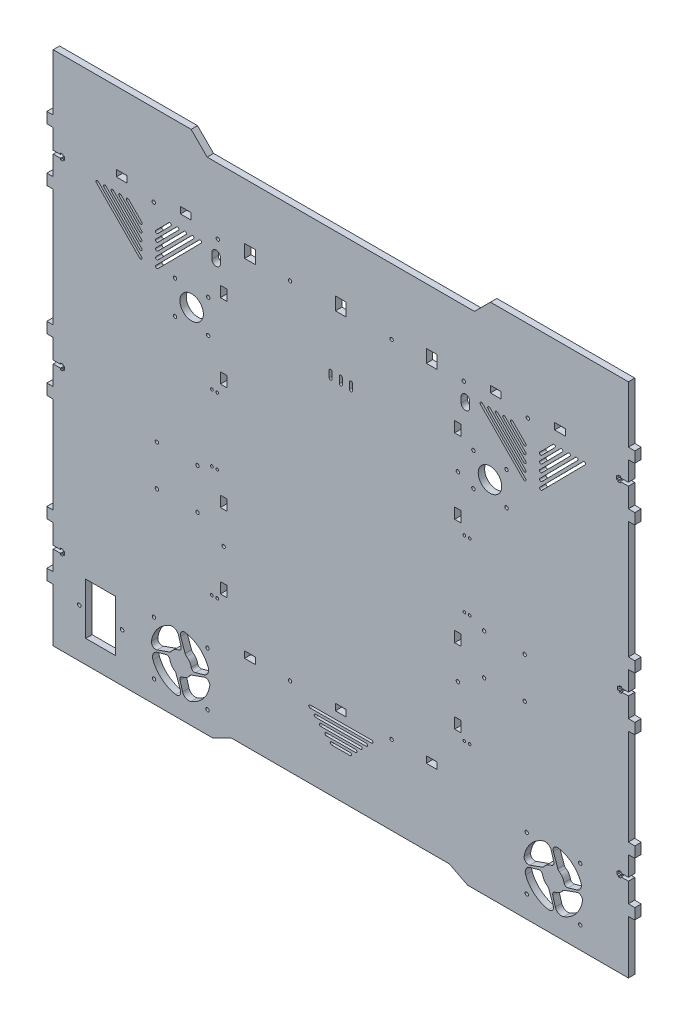
from build123d import *

# Parameters (mm, degrees)
SKETCH_1_R      = 1.6
SKETCH_1_R_2    = 11
SKETCH_1_R_3    = 1.65
SKETCH_1_R_4    = 1.25
SKETCH_1_W      = 10
SKETCH_1_H      = 12.1
SKETCH_1_H_2    = 6.1
SKETCH_1_W_2    = 28.000005
SKETCH_1_H_3    = 48
SKETCH_1_W_3    = 6.1
SKETCH_1_H_4    = 10
EXTRUDE_1_DEPTH = 6


with BuildPart() as part:
    # Эскиз1 → Бобышка-Вытянуть1 (new body)
    with BuildSketch(Plane.XY):
        Polygon((1048.755445299, 41.555928029), (1198.275289364, 41.555928029), (1215.275289364, 50.255928029), (1419.275289364, 50.255928029), (1436.275289364, 41.555928029), (1586.755445299, 41.555928029), (1586.755445299, 42.229895243), (1586.755445299, 91.455928029), (1592.755445299, 91.555920983), (1592.755445299, 101.564061487), (1586.755445299, 101.664059139), (1586.755445299, 120.014059139), (1579.955445299, 120.014059139), (1579.955445299, 118.814059139), (1577.755445299, 118.814059139), (1577.755445299, 120.014059139), (1576.255445299, 120.014059139), (1576.255445299, 123.114059139), (1577.755445299, 123.114059139), (1577.755445299, 124.314059139), (1579.955445299, 124.314059139), (1579.955445299, 123.114059139), (1586.755445299, 123.114059139), (1586.755445299, 141.464059139), (1592.755445299, 141.564052092), (1592.755445299, 151.572190055), (1586.755445299, 151.672187707), (1586.755445299, 241.472187707), (1592.755445299, 241.57218066), (1592.755445299, 251.580316084), (1586.755445299, 251.680313736), (1586.755445299, 270.030313736), (1580.435601234, 270.030313736), (1580.435601234, 268.830313736), (1578.235601234, 268.830313736), (1578.235601234, 270.030313736), (1576.735601234, 270.030313736), (1576.735601234, 273.130313736), (1578.235601234, 273.130313736), (1578.235601234, 274.330313736), (1580.435601234, 274.330313736), (1580.435601234, 273.130313736), (1586.755445299, 273.130313736), (1586.755445299, 291.44780454), (1592.755445299, 291.547797493), (1592.755445299, 301.555930378), (1586.755445299, 301.655928029), (1586.755445299, 411.455928029), (1592.755445299, 411.555920983), (1592.755445299, 421.555920983), (1586.755445299, 421.64840618), (1586.755445299, 440.010210156), (1586.047206734, 440.010210156), (1579.247206734, 440.010210156), (1579.247206734, 438.810210156), (1577.047206734, 438.810210156), (1577.047206734, 440.010210156), (1575.547206734, 440.010210156), (1575.547206734, 443.110210156), (1577.047206734, 443.110210156), (1577.047206734, 444.310210156), (1579.247206734, 444.310210156), (1579.247206734, 443.110210156), (1586.047206734, 443.110210156), (1586.755445299, 443.110210156), (1586.755445299, 461.472014132), (1592.755445299, 461.564485239), (1592.755445299, 471.555920983), (1586.755445299, 471.64840618), (1586.755445299, 524.555928029), (1457.755445299, 524.555928029), (1442.755445299, 509.555928029), (1192.755445299, 509.555928029), (1177.755445299, 524.555928029), (1048.755445299, 524.555928029), (1048.755445299, 471.655928029), (1042.755445299, 471.555928029), (1042.755445299, 461.555928029), (1048.755445299, 461.455928029), (1048.755445299, 443.105928029), (1055.555445299, 443.105928029), (1055.555445299, 444.305928029), (1057.755445299, 444.305928029), (1057.755445299, 443.105928029), (1059.255445299, 443.105928029), (1059.255445299, 440.005928029), (1057.755445299, 440.005928029), (1057.755445299, 438.805928029), (1055.555445299, 438.805928029), (1055.555445299, 440.005928029), (1048.755445299, 440.005928029), (1048.755445299, 421.655928029), (1042.755445299, 421.555928029), (1042.755445299, 411.555928029), (1048.755445299, 411.455928029), (1048.755445299, 301.655928029), (1042.755445299, 301.555928029), (1042.755445299, 291.555928029), (1048.755445299, 291.455928029), (1048.755445299, 273.105928029), (1055.555445299, 273.105928029), (1055.555445299, 274.305928029), (1057.755445299, 274.305928029), (1057.755445299, 273.105928029), (1059.255445299, 273.105928029), (1059.255445299, 270.005928029), (1057.755445299, 270.005928029), (1057.755445299, 268.805928029), (1055.555445299, 268.805928029), (1055.555445299, 270.005928029), (1048.755445299, 270.005928029), (1048.755445299, 251.655928029), (1042.755445299, 251.555928029), (1042.755445299, 241.555928029), (1048.755445299, 241.455928029), (1048.755445299, 151.655928029), (1042.755445299, 151.555928029), (1042.755445299, 141.555928029), (1048.755445299, 141.455928029), (1048.755445299, 123.105928029), (1055.555445299, 123.105928029), (1055.555445299, 124.305928029), (1057.755445299, 124.305928029), (1057.755445299, 123.105928029), (1059.255445299, 123.105928029), (1059.255445299, 120.005928029), (1057.755445299, 120.005928029), (1057.755445299, 118.805928029), (1055.555445299, 118.805928029), (1055.555445299, 120.005928029), (1048.755445299, 120.005928029), (1048.755445299, 101.655928029), (1042.755445299, 101.555928029), (1042.755445299, 91.555928029), (1048.755445299, 91.455928029), (1048.755445299, 42.225613117), align=None)
        with Locations((1193.706756289, 365.50723902)):
            Circle(SKETCH_1_R, mode=Mode.SUBTRACT)
        with Locations((1162.706756289, 365.50723902)):
            Circle(SKETCH_1_R, mode=Mode.SUBTRACT)
        with Locations((1178.206756289, 380.555928029)):
            Circle(SKETCH_1_R_2, mode=Mode.SUBTRACT)
        with Locations((1193.706756289, 396.50723902)):
            Circle(SKETCH_1_R, mode=Mode.SUBTRACT)
        with Locations((1202.755445299, 448.05723902)):
            Circle(SKETCH_1_R, mode=Mode.SUBTRACT)
        with Locations((1432.755445299, 448.05723902)):
            Circle(SKETCH_1_R, mode=Mode.SUBTRACT)
        with Locations((1365.255445299, 448.05723902)):
            Circle(SKETCH_1_R, mode=Mode.SUBTRACT)
        with Locations((1270.255445299, 448.05723902)):
            Circle(SKETCH_1_R, mode=Mode.SUBTRACT)
        with Locations((1162.706756289, 396.50723902)):
            Circle(SKETCH_1_R, mode=Mode.SUBTRACT)
        with Locations((1145.712920123, 217.273882543)):
            Circle(SKETCH_1_R, mode=Mode.SUBTRACT)
        with Locations((1365.255445299, 124.05491402)):
            Circle(SKETCH_1_R, mode=Mode.SUBTRACT)
        with Locations((1270.255445299, 124.05491402)):
            Circle(SKETCH_1_R, mode=Mode.SUBTRACT)
        with Locations((1492.755445299, 448.05723902)):
            Circle(SKETCH_1_R, mode=Mode.SUBTRACT)
        with Locations((1142.755445299, 448.05723902)):
            Circle(SKETCH_1_R, mode=Mode.SUBTRACT)
        with Locations((1073.162844871, 86.87758802)):
            Circle(SKETCH_1_R_3, mode=Mode.SUBTRACT)
        with Locations((1113.162844871, 86.87758802)):
            Circle(SKETCH_1_R_3, mode=Mode.SUBTRACT)
        with Locations((1145.712920123, 255.273882543)):
            Circle(SKETCH_1_R, mode=Mode.SUBTRACT)
        with Locations((1183.712920123, 217.273882543)):
            Circle(SKETCH_1_R, mode=Mode.SUBTRACT)
        with Locations((1183.712920123, 255.273882543)):
            Circle(SKETCH_1_R, mode=Mode.SUBTRACT)
        with Locations((1143.031783229, 112.012971893)):
            Circle(SKETCH_1_R, mode=Mode.SUBTRACT)
        with Locations((1143.031783229, 62.012971893)):
            Circle(SKETCH_1_R, mode=Mode.SUBTRACT)
        with Locations((1541.689341871, 112.012971893)):
            Circle(SKETCH_1_R, mode=Mode.SUBTRACT)
        with Locations((1541.689341871, 62.012971893)):
            Circle(SKETCH_1_R, mode=Mode.SUBTRACT)
        with Locations((1491.689341871, 112.012971893)):
            Circle(SKETCH_1_R, mode=Mode.SUBTRACT)
        with Locations((1491.689341871, 62.012971893)):
            Circle(SKETCH_1_R, mode=Mode.SUBTRACT)
        with Locations((1193.031783229, 62.012971893)):
            Circle(SKETCH_1_R, mode=Mode.SUBTRACT)
        with Locations((1193.031783229, 112.012971893)):
            Circle(SKETCH_1_R, mode=Mode.SUBTRACT)
        with Locations((1427.305445299, 371.90723902)):
            Circle(SKETCH_1_R, mode=Mode.SUBTRACT)
        with Locations((1427.305445299, 201.90723902)):
            Circle(SKETCH_1_R, mode=Mode.SUBTRACT)
        with Locations((1208.205445299, 201.90723902)):
            Circle(SKETCH_1_R, mode=Mode.SUBTRACT)
        with Locations((1202.195892293, 261.19163302)):
            Circle(SKETCH_1_R_4, mode=Mode.SUBTRACT)
        with Locations((1197.224537293, 261.25949102)):
            Circle(SKETCH_1_R_4, mode=Mode.SUBTRACT)
        with Locations((1202.158586293, 156.83802302)):
            Circle(SKETCH_1_R_4, mode=Mode.SUBTRACT)
        with Locations((1197.187231293, 156.90588202)):
            Circle(SKETCH_1_R_4, mode=Mode.SUBTRACT)
        with Locations((1438.308804299, 156.77016502)):
            Circle(SKETCH_1_R_4, mode=Mode.SUBTRACT)
        with Locations((1433.337449299, 156.83802402)):
            Circle(SKETCH_1_R_4, mode=Mode.SUBTRACT)
        with Locations((1472.804134308, 365.50723902)):
            Circle(SKETCH_1_R, mode=Mode.SUBTRACT)
        with Locations((1438.346110299, 261.12377502)):
            Circle(SKETCH_1_R_4, mode=Mode.SUBTRACT)
        with Locations((1441.804134308, 365.50723902)):
            Circle(SKETCH_1_R, mode=Mode.SUBTRACT)
        with Locations((1433.374755299, 261.19163302)):
            Circle(SKETCH_1_R_4, mode=Mode.SUBTRACT)
        with Locations((1441.804134308, 396.50723902)):
            Circle(SKETCH_1_R, mode=Mode.SUBTRACT)
        with Locations((1438.326800299, 323.41350502)):
            Circle(SKETCH_1_R_4, mode=Mode.SUBTRACT)
        with Locations((1457.304134308, 380.555928029)):
            Circle(SKETCH_1_R_2, mode=Mode.SUBTRACT)
        with Locations((1433.355445299, 323.48136302)):
            Circle(SKETCH_1_R_4, mode=Mode.SUBTRACT)
        with Locations((1472.804134308, 396.50723902)):
            Circle(SKETCH_1_R, mode=Mode.SUBTRACT)
        with Locations((1489.797970474, 217.273882543)):
            Circle(SKETCH_1_R, mode=Mode.SUBTRACT)
        with Locations((1451.797970474, 217.273882543)):
            Circle(SKETCH_1_R, mode=Mode.SUBTRACT)
        with Locations((1451.797970474, 255.273882543)):
            Circle(SKETCH_1_R, mode=Mode.SUBTRACT)
        with Locations((1489.797970474, 255.273882543)):
            Circle(SKETCH_1_R, mode=Mode.SUBTRACT)
        with Locations((1202.176582293, 323.48136302)):
            Circle(SKETCH_1_R_4, mode=Mode.SUBTRACT)
        with Locations((1197.205227293, 323.54922102)):
            Circle(SKETCH_1_R_4, mode=Mode.SUBTRACT)
        with Locations((1402.755445299, 451.05723902)):
            Rectangle(SKETCH_1_W, SKETCH_1_H, mode=Mode.SUBTRACT)
        with BuildLine():
            Line((1197.155445299, 434.474322287), (1197.155445299, 429.191381807))
            ThreePointArc((1197.155445299, 429.191381807), (1198.327018174, 426.362954683), (1201.155445299, 425.191381807))
            ThreePointArc((1201.155445299, 425.191381807), (1203.983872423, 426.362954683), (1205.155445299, 429.191381807))
            Line((1205.155445299, 429.191381807), (1205.155445299, 434.474322287))
            ThreePointArc((1205.155445299, 434.474322287), (1203.983872423, 437.302749411), (1201.155445299, 438.474322287))
            ThreePointArc((1201.155445299, 438.474322287), (1198.327018174, 437.302749411), (1197.155445299, 434.474322287))
        make_face(mode=Mode.SUBTRACT)
        with BuildLine():
            Line((1503.96657517, 426.229073018), (1516.272389171, 438.671618019))
            ThreePointArc((1516.272389171, 438.671618019), (1518.040128671, 438.681384518), (1518.04989517, 436.913645018))
            Line((1518.04989517, 436.913645018), (1505.744081454, 424.471099305))
            ThreePointArc((1505.744081454, 424.471099305), (1503.976341456, 424.46133302), (1503.96657517, 426.229073018))
        make_face(mode=Mode.SUBTRACT)
        with BuildLine():
            Line((1546.33373517, 437.069909018), (1505.900345932, 396.187259778))
            ThreePointArc((1505.900345932, 396.187259778), (1504.132605931, 396.177493017), (1504.12283917, 397.945233018))
            Line((1504.12283917, 397.945233018), (1544.556229171, 438.827882019))
            ThreePointArc((1544.556229171, 438.827882019), (1546.323968671, 438.837648518), (1546.33373517, 437.069909018))
        make_face(mode=Mode.SUBTRACT)
        with Locations((1232.755445299, 451.05723902)):
            Rectangle(SKETCH_1_W, SKETCH_1_H, mode=Mode.SUBTRACT)
        with Locations((1317.755445299, 451.05723902)):
            Rectangle(SKETCH_1_W, SKETCH_1_H, mode=Mode.SUBTRACT)
        with BuildLine():
            Line((1525.12085517, 436.952711018), (1505.783147441, 417.400139292))
            ThreePointArc((1505.783147441, 417.400139292), (1504.015407443, 417.39037302), (1504.00564117, 419.158113018))
            Line((1504.00564117, 419.158113018), (1523.343349171, 438.710684019))
            ThreePointArc((1523.343349171, 438.710684019), (1525.111088671, 438.720450518), (1525.12085517, 436.952711018))
        make_face(mode=Mode.SUBTRACT)
        with BuildLine():
            Line((1504.08377317, 405.016193018), (1537.485269171, 438.788816019))
            ThreePointArc((1537.485269171, 438.788816019), (1539.253008671, 438.798582518), (1539.26277517, 437.030843018))
            Line((1539.26277517, 437.030843018), (1505.861280197, 403.258219046))
            ThreePointArc((1505.861280197, 403.258219046), (1504.093539698, 403.248452518), (1504.08377317, 405.016193018))
        make_face(mode=Mode.SUBTRACT)
        with Locations((1172.755445299, 454.05723902)):
            Rectangle(SKETCH_1_W, SKETCH_1_H_2, mode=Mode.SUBTRACT)
        with BuildLine():
            Line((1532.19181517, 436.991777018), (1505.822213435, 410.329179286))
            ThreePointArc((1505.822213435, 410.329179286), (1504.054473437, 410.31941302), (1504.04470717, 412.087153018))
            Line((1504.04470717, 412.087153018), (1530.414309171, 438.749750019))
            ThreePointArc((1530.414309171, 438.749750019), (1532.182048671, 438.759516518), (1532.19181517, 436.991777018))
        make_face(mode=Mode.SUBTRACT)
        with Locations((1462.755445299, 454.05723902)):
            Rectangle(SKETCH_1_W, SKETCH_1_H_2, mode=Mode.SUBTRACT)
        with BuildLine():
            Line((1131.388051427, 397.945233018), (1090.954661426, 438.827882019))
            ThreePointArc((1090.954661426, 438.827882019), (1089.186921926, 438.837648518), (1089.177155427, 437.069909018))
            Line((1089.177155427, 437.069909018), (1129.610544665, 396.187259778))
            ThreePointArc((1129.610544665, 396.187259778), (1131.378284666, 396.177493017), (1131.388051427, 397.945233018))
        make_face(mode=Mode.SUBTRACT)
        with BuildLine():
            Line((1096.248115427, 437.030843018), (1129.6496104, 403.258219046))
            ThreePointArc((1129.6496104, 403.258219046), (1131.417350899, 403.248452518), (1131.427117427, 405.016193018))
            Line((1131.427117427, 405.016193018), (1098.025621426, 438.788816019))
            ThreePointArc((1098.025621426, 438.788816019), (1096.257881926, 438.798582518), (1096.248115427, 437.030843018))
        make_face(mode=Mode.SUBTRACT)
        with BuildLine():
            Line((1131.466183427, 412.087153018), (1105.096581426, 438.749750019))
            ThreePointArc((1105.096581426, 438.749750019), (1103.328841926, 438.759516518), (1103.319075427, 436.991777018))
            Line((1103.319075427, 436.991777018), (1129.688677162, 410.329179286))
            ThreePointArc((1129.688677162, 410.329179286), (1131.45641716, 410.31941302), (1131.466183427, 412.087153018))
        make_face(mode=Mode.SUBTRACT)
        with BuildLine():
            Line((1131.505249427, 419.158113018), (1112.167541426, 438.710684019))
            ThreePointArc((1112.167541426, 438.710684019), (1110.399801926, 438.720450518), (1110.390035427, 436.952711018))
            Line((1110.390035427, 436.952711018), (1129.727743156, 417.400139292))
            ThreePointArc((1129.727743156, 417.400139292), (1131.495483154, 417.39037302), (1131.505249427, 419.158113018))
        make_face(mode=Mode.SUBTRACT)
        with BuildLine():
            Line((1131.544315427, 426.229073018), (1119.238501426, 438.671618019))
            ThreePointArc((1119.238501426, 438.671618019), (1117.470761926, 438.681384518), (1117.460995427, 436.913645018))
            Line((1117.460995427, 436.913645018), (1129.766809143, 424.471099305))
            ThreePointArc((1129.766809143, 424.471099305), (1131.534549141, 424.46133302), (1131.544315427, 426.229073018))
        make_face(mode=Mode.SUBTRACT)
        with BuildLine():
            Line((1144.920952759, 397.945233486), (1185.354342039, 438.827882757))
            ThreePointArc((1185.354342039, 438.827882757), (1187.122082038, 438.837649018), (1187.131848299, 437.06990902))
            Line((1187.131848299, 437.06990902), (1146.698459299, 396.18726002))
            ThreePointArc((1146.698459299, 396.18726002), (1144.930719296, 396.177493483), (1144.920952759, 397.945233486))
        make_face(mode=Mode.SUBTRACT)
        with Locations((1402.755445299, 124.05491402)):
            Rectangle(SKETCH_1_W, SKETCH_1_H_2, mode=Mode.SUBTRACT)
        with Locations((1317.755445299, 124.05491402)):
            Rectangle(SKETCH_1_W, SKETCH_1_H_2, mode=Mode.SUBTRACT)
        with Locations((1232.755445299, 124.05491402)):
            Rectangle(SKETCH_1_W, SKETCH_1_H_2, mode=Mode.SUBTRACT)
        with Locations((1093.162846371, 86.87758802)):
            Rectangle(SKETCH_1_W_2, SKETCH_1_H_3, mode=Mode.SUBTRACT)
        with BuildLine():
            Line((1455.450001299, 437.03084302), (1488.851497299, 403.25822002))
            ThreePointArc((1488.851497299, 403.25822002), (1490.619237301, 403.248453504), (1490.629003817, 405.016193507))
            Line((1490.629003817, 405.016193507), (1457.22750805, 438.788816271))
            ThreePointArc((1457.22750805, 438.788816271), (1455.459768049, 438.798583021), (1455.450001299, 437.03084302))
        make_face(mode=Mode.SUBTRACT)
        with BuildLine():
            Line((1144.88188678, 405.016193507), (1178.283382547, 438.788816271))
            ThreePointArc((1178.283382547, 438.788816271), (1180.051122548, 438.798583021), (1180.060889299, 437.03084302))
            Line((1180.060889299, 437.03084302), (1146.659393299, 403.25822002))
            ThreePointArc((1146.659393299, 403.25822002), (1144.891653296, 403.248453504), (1144.88188678, 405.016193507))
        make_face(mode=Mode.SUBTRACT)
        with BuildLine():
            Line((1172.989929299, 436.99177702), (1146.620327299, 410.32917902))
            ThreePointArc((1146.620327299, 410.32917902), (1144.852586799, 410.319412517), (1144.842820296, 412.087153017))
            Line((1144.842820296, 412.087153017), (1171.212422547, 438.749750271))
            ThreePointArc((1171.212422547, 438.749750271), (1172.980162548, 438.759517021), (1172.989929299, 436.99177702))
        make_face(mode=Mode.SUBTRACT)
        with BuildLine():
            Line((1144.803754296, 419.158113017), (1164.141462547, 438.710684271))
            ThreePointArc((1164.141462547, 438.710684271), (1165.909202548, 438.720451021), (1165.918969299, 436.95271102))
            Line((1165.918969299, 436.95271102), (1146.581261299, 417.40013902))
            ThreePointArc((1146.581261299, 417.40013902), (1144.813520799, 417.390372517), (1144.803754296, 419.158113017))
        make_face(mode=Mode.SUBTRACT)
        with BuildLine():
            Line((1158.848009299, 436.91364502), (1146.542195299, 424.47109902))
            ThreePointArc((1146.542195299, 424.47109902), (1144.774454799, 424.461332517), (1144.764688295, 426.229073017))
            Line((1144.764688295, 426.229073017), (1157.070502547, 438.671618271))
            ThreePointArc((1157.070502547, 438.671618271), (1158.838242548, 438.681385021), (1158.848009299, 436.91364502))
        make_face(mode=Mode.SUBTRACT)
        with BuildLine():
            Line((1430.355445299, 429.191381807), (1430.355445299, 434.474322287))
            ThreePointArc((1430.355445299, 434.474322287), (1431.527018174, 437.302749411), (1434.355445299, 438.474322287))
            ThreePointArc((1434.355445299, 438.474322287), (1437.183872423, 437.302749411), (1438.355445299, 434.474322287))
            Line((1438.355445299, 434.474322287), (1438.355445299, 429.191381807))
            ThreePointArc((1438.355445299, 429.191381807), (1437.183872423, 426.362954683), (1434.355445299, 425.191381807))
            ThreePointArc((1434.355445299, 425.191381807), (1431.527018174, 426.362954683), (1430.355445299, 429.191381807))
        make_face(mode=Mode.SUBTRACT)
        with BuildLine():
            Line((1326.629180083, 91.617684324), (1309.129447611, 91.521000907))
            ThreePointArc((1309.129447611, 91.521000907), (1307.872560358, 92.764075536), (1309.115634987, 94.020962789))
            Line((1309.115634987, 94.020962789), (1326.615368167, 94.1176455))
            ThreePointArc((1326.615368167, 94.1176455), (1327.872254713, 92.87457087), (1326.629180083, 91.617684324))
        make_face(mode=Mode.SUBTRACT)
        with BuildLine():
            Line((1331.601480015, 96.645231923), (1304.101899305, 96.493300132))
            ThreePointArc((1304.101899305, 96.493300132), (1302.845012759, 97.736375468), (1304.088088096, 98.993262014))
            Line((1304.088088096, 98.993262014), (1331.587668099, 99.145193099))
            ThreePointArc((1331.587668099, 99.145193099), (1332.844554645, 97.902118469), (1331.601480015, 96.645231923))
        make_face(mode=Mode.SUBTRACT)
        with BuildLine():
            Line((1336.573779947, 101.672779522), (1299.074351706, 101.465600064))
            ThreePointArc((1299.074351706, 101.465600064), (1297.81746516, 102.7086754), (1299.060540497, 103.965561946))
            Line((1299.060540497, 103.965561946), (1336.559967324, 104.172741405))
            ThreePointArc((1336.559967324, 104.172741405), (1337.816854577, 102.929666775), (1336.573779947, 101.672779522))
        make_face(mode=Mode.SUBTRACT)
        with BuildLine():
            Line((1289.005445299, 113.91016181), (1346.504567188, 114.227836603))
            ThreePointArc((1346.504567188, 114.227836603), (1347.761454441, 112.984761973), (1346.518379811, 111.72787472))
            Line((1346.518379811, 111.72787472), (1289.019256508, 111.410199928))
            ThreePointArc((1289.019256508, 111.410199928), (1287.762369962, 112.653275264), (1289.005445299, 113.91016181))
        make_face(mode=Mode.SUBTRACT)
        with BuildLine():
            Line((1341.546079879, 106.700327121), (1294.046804107, 106.437899996))
            ThreePointArc((1294.046804107, 106.437899996), (1292.789917561, 107.680975332), (1294.032992898, 108.937861878))
            Line((1294.032992898, 108.937861878), (1341.532267256, 109.200289004))
            ThreePointArc((1341.532267256, 109.200289004), (1342.789154509, 107.957214374), (1341.546079879, 106.700327121))
        make_face(mode=Mode.SUBTRACT)
        with BuildLine():
            Line((1448.379042299, 437.06990902), (1488.812431299, 396.18726002))
            ThreePointArc((1488.812431299, 396.18726002), (1490.580171301, 396.177493483), (1490.589937838, 397.945233486))
            Line((1490.589937838, 397.945233486), (1450.156548558, 438.827882757))
            ThreePointArc((1450.156548558, 438.827882757), (1448.388808559, 438.837649018), (1448.379042299, 437.06990902))
        make_face(mode=Mode.SUBTRACT)
        with BuildLine():
            Line((1469.591921299, 436.95271102), (1488.929629299, 417.40013902))
            ThreePointArc((1488.929629299, 417.40013902), (1490.697369798, 417.390372517), (1490.707136301, 419.158113017))
            Line((1490.707136301, 419.158113017), (1471.36942805, 438.710684271))
            ThreePointArc((1471.36942805, 438.710684271), (1469.601688049, 438.720451021), (1469.591921299, 436.95271102))
        make_face(mode=Mode.SUBTRACT)
        with BuildLine():
            Line((1476.662881299, 436.91364502), (1488.968695299, 424.47109902))
            ThreePointArc((1488.968695299, 424.47109902), (1490.736435798, 424.461332517), (1490.746202302, 426.229073017))
            Line((1490.746202302, 426.229073017), (1478.44038805, 438.671618271))
            ThreePointArc((1478.44038805, 438.671618271), (1476.672648049, 438.681385021), (1476.662881299, 436.91364502))
        make_face(mode=Mode.SUBTRACT)
        with BuildLine():
            Line((1462.520961299, 436.99177702), (1488.890563299, 410.32917902))
            ThreePointArc((1488.890563299, 410.32917902), (1490.658303798, 410.319412517), (1490.668070301, 412.087153017))
            Line((1490.668070301, 412.087153017), (1464.29846805, 438.749750271))
            ThreePointArc((1464.29846805, 438.749750271), (1462.530728049, 438.759517021), (1462.520961299, 436.99177702))
        make_face(mode=Mode.SUBTRACT)
        with BuildLine():
            Line((1530.317428095, 86.376861737), (1538.475232454, 88.733710728))
            ThreePointArc((1538.475232454, 88.733710728), (1542.17332586, 91.808427073), (1542.425449513, 96.611156411))
            ThreePointArc((1542.425449513, 96.611156411), (1534.073793622, 108.256420171), (1521.01322148, 114.154197673))
            ThreePointArc((1521.01322148, 114.154197673), (1517.29590567, 112.767766584), (1516.60124357, 108.861608297))
            Line((1516.60124357, 108.861608297), (1520.758003302, 97.218443933))
            ThreePointArc((1520.758003302, 97.218443933), (1521.358855676, 96.119028752), (1522.270346342, 95.259422982))
            ThreePointArc((1522.270346342, 95.259422982), (1525.056734388, 92.412613), (1526.534776336, 88.713467502))
            ThreePointArc((1526.534776336, 88.713467502), (1527.908153618, 86.706675217), (1530.317428095, 86.376861737))
        make_face(mode=Mode.SUBTRACT)
        with BuildLine():
            Line((1494.55707538, 86.909353323), (1506.20023984, 91.066114192))
            ThreePointArc((1506.20023984, 91.066114192), (1507.29965486, 91.666966573), (1508.159260507, 92.578457166))
            ThreePointArc((1508.159260507, 92.578457166), (1511.006070681, 95.364845404), (1514.70521647, 96.842887354))
            ThreePointArc((1514.70521647, 96.842887354), (1516.712008813, 98.216264561), (1517.041822384, 100.625539031))
            Line((1517.041822384, 100.625539031), (1514.684973929, 108.783342647))
            ThreePointArc((1514.684973929, 108.783342647), (1511.610257778, 112.481436135), (1506.807528513, 112.73356004))
            ThreePointArc((1506.807528513, 112.73356004), (1495.162263635, 104.381904059), (1489.264485679, 91.321331066))
            ThreePointArc((1489.264485679, 91.321331066), (1490.650916926, 87.604015185), (1494.55707538, 86.909353323))
        make_face(mode=Mode.SUBTRACT)
        with BuildLine():
            Line((1502.766409655, 87.3542366), (1494.608606517, 84.997388283))
            ThreePointArc((1494.608606517, 84.997388283), (1490.910512973, 81.92267202), (1490.658389213, 77.119942632))
            ThreePointArc((1490.658389213, 77.119942632), (1499.010045139, 65.474678548), (1512.070617536, 59.576900922))
            ThreePointArc((1512.070617536, 59.576900922), (1515.787933469, 60.963332183), (1516.482595285, 64.869490698))
            Line((1516.482595285, 64.869490698), (1512.325834508, 76.512654108))
            ThreePointArc((1512.325834508, 76.512654108), (1511.724982125, 77.612069087), (1510.813491551, 78.471674702))
            ThreePointArc((1510.813491551, 78.471674702), (1508.027103292, 81.318484881), (1506.549061331, 85.017630686))
            ThreePointArc((1506.549061331, 85.017630686), (1505.175684124, 87.024423029), (1502.766409655, 87.3542366))
        make_face(mode=Mode.SUBTRACT)
        with BuildLine():
            Line((1538.537978168, 86.806225385), (1526.894813708, 82.649464517))
            ThreePointArc((1526.894813708, 82.649464517), (1525.795398688, 82.048612136), (1524.935793041, 81.137121543))
            ThreePointArc((1524.935793041, 81.137121543), (1522.088983162, 78.350733496), (1518.389837768, 76.872691482))
            ThreePointArc((1518.389837768, 76.872691482), (1516.383045574, 75.499314225), (1516.053232058, 73.090039843))
            Line((1516.053232058, 73.090039843), (1518.410080468, 64.932236381))
            ThreePointArc((1518.410080468, 64.932236381), (1521.484796731, 61.234142837), (1526.287526119, 60.982019077))
            ThreePointArc((1526.287526119, 60.982019077), (1537.932790281, 69.333675098), (1543.830567869, 82.394247642))
            ThreePointArc((1543.830567869, 82.394247642), (1542.444136622, 86.111563523), (1538.537978168, 86.806225385))
        make_face(mode=Mode.SUBTRACT)
        with Locations((1522.755445299, 454.05723902)):
            Rectangle(SKETCH_1_W, SKETCH_1_H_2, mode=Mode.SUBTRACT)
        with Locations((1112.755445299, 454.05723902)):
            Rectangle(SKETCH_1_W, SKETCH_1_H_2, mode=Mode.SUBTRACT)
        with BuildLine():
            Line((1167.825036644, 64.869490698), (1163.668275867, 76.512654108))
            ThreePointArc((1163.668275867, 76.512654108), (1163.067423484, 77.612069087), (1162.155932909, 78.471674702))
            ThreePointArc((1162.155932909, 78.471674702), (1159.36954465, 81.318484881), (1157.89150269, 85.017630686))
            ThreePointArc((1157.89150269, 85.017630686), (1156.518125483, 87.024423029), (1154.108851013, 87.3542366))
            Line((1154.108851013, 87.3542366), (1145.951047876, 84.997388283))
            ThreePointArc((1145.951047876, 84.997388283), (1142.252954332, 81.92267202), (1142.000830572, 77.119942632))
            ThreePointArc((1142.000830572, 77.119942632), (1150.352486498, 65.474678548), (1163.413058895, 59.576900922))
            ThreePointArc((1163.413058895, 59.576900922), (1167.130374827, 60.963332183), (1167.825036644, 64.869490698))
        make_face(mode=Mode.SUBTRACT)
        with Locations((1427.305445299, 406.90723902)):
            Rectangle(SKETCH_1_W_3, SKETCH_1_H_4, mode=Mode.SUBTRACT)
        with Locations((1427.305445299, 336.90723902)):
            Rectangle(SKETCH_1_W_3, SKETCH_1_H_4, mode=Mode.SUBTRACT)
        with Locations((1427.305445299, 236.90723902)):
            Rectangle(SKETCH_1_W_3, SKETCH_1_H_4, mode=Mode.SUBTRACT)
        with Locations((1427.305445299, 166.90723902)):
            Rectangle(SKETCH_1_W_3, SKETCH_1_H_4, mode=Mode.SUBTRACT)
        with Locations((1208.205445299, 166.90723902)):
            Rectangle(SKETCH_1_W_3, SKETCH_1_H_4, mode=Mode.SUBTRACT)
        with Locations((1208.205445299, 236.90723902)):
            Rectangle(SKETCH_1_W_3, SKETCH_1_H_4, mode=Mode.SUBTRACT)
        with Locations((1208.205445299, 336.90723902)):
            Rectangle(SKETCH_1_W_3, SKETCH_1_H_4, mode=Mode.SUBTRACT)
        with Locations((1208.205445299, 406.90723902)):
            Rectangle(SKETCH_1_W_3, SKETCH_1_H_4, mode=Mode.SUBTRACT)
        with BuildLine():
            Line((1145.899516738, 86.909353323), (1157.542681199, 91.066114192))
            ThreePointArc((1157.542681199, 91.066114192), (1158.642096219, 91.666966573), (1159.501701866, 92.578457166))
            ThreePointArc((1159.501701866, 92.578457166), (1162.348512039, 95.364845404), (1166.047657828, 96.842887354))
            ThreePointArc((1166.047657828, 96.842887354), (1168.054450172, 98.216264561), (1168.384263743, 100.625539031))
            Line((1168.384263743, 100.625539031), (1166.027415288, 108.783342647))
            ThreePointArc((1166.027415288, 108.783342647), (1162.952699137, 112.481436135), (1158.149969872, 112.73356004))
            ThreePointArc((1158.149969872, 112.73356004), (1146.504704993, 104.381904059), (1140.606927038, 91.321331066))
            ThreePointArc((1140.606927038, 91.321331066), (1141.993358285, 87.604015185), (1145.899516738, 86.909353323))
        make_face(mode=Mode.SUBTRACT)
        with BuildLine():
            Line((1189.880419527, 86.806225385), (1178.237255066, 82.649464517))
            ThreePointArc((1178.237255066, 82.649464517), (1177.137840046, 82.048612136), (1176.2782344, 81.137121543))
            ThreePointArc((1176.2782344, 81.137121543), (1173.43142452, 78.350733496), (1169.732279127, 76.872691482))
            ThreePointArc((1169.732279127, 76.872691482), (1167.725486933, 75.499314225), (1167.395673416, 73.090039843))
            Line((1167.395673416, 73.090039843), (1169.752521827, 64.932236381))
            ThreePointArc((1169.752521827, 64.932236381), (1172.82723809, 61.234142837), (1177.629967478, 60.982019077))
            ThreePointArc((1177.629967478, 60.982019077), (1189.275231639, 69.333675098), (1195.173009228, 82.394247642))
            ThreePointArc((1195.173009228, 82.394247642), (1193.78657798, 86.111563523), (1189.880419527, 86.806225385))
        make_face(mode=Mode.SUBTRACT)
        with BuildLine():
            Line((1181.659869454, 86.376861737), (1189.817673812, 88.733710728))
            ThreePointArc((1189.817673812, 88.733710728), (1193.515767218, 91.808427073), (1193.767890872, 96.611156411))
            ThreePointArc((1193.767890872, 96.611156411), (1185.416234981, 108.256420171), (1172.355662838, 114.154197673))
            ThreePointArc((1172.355662838, 114.154197673), (1168.638347028, 112.767766584), (1167.943684929, 108.861608297))
            Line((1167.943684929, 108.861608297), (1172.100444661, 97.218443933))
            ThreePointArc((1172.100444661, 97.218443933), (1172.701297034, 96.119028752), (1173.6127877, 95.259422982))
            ThreePointArc((1173.6127877, 95.259422982), (1176.399175747, 92.412613), (1177.877217694, 88.713467502))
            ThreePointArc((1177.877217694, 88.713467502), (1179.250594977, 86.706675217), (1181.659869454, 86.376861737))
        make_face(mode=Mode.SUBTRACT)
        with BuildLine():
            Line((1325.855445299, 394.044239538), (1325.855445299, 388.044239538))
            ThreePointArc((1325.855445299, 388.044239538), (1327.255445299, 386.644239538), (1328.655445299, 388.044239538))
            Line((1328.655445299, 388.044239538), (1328.655445299, 394.044239538))
            ThreePointArc((1328.655445299, 394.044239538), (1327.255445299, 395.444239538), (1325.855445299, 394.044239538))
        make_face(mode=Mode.SUBTRACT)
        with BuildLine():
            Line((1316.355445299, 394.044239538), (1316.355445299, 388.044239538))
            ThreePointArc((1316.355445299, 388.044239538), (1317.755445299, 386.644239538), (1319.155445299, 388.044239538))
            Line((1319.155445299, 388.044239538), (1319.155445299, 394.044239538))
            ThreePointArc((1319.155445299, 394.044239538), (1317.755445299, 395.444239538), (1316.355445299, 394.044239538))
        make_face(mode=Mode.SUBTRACT)
        with BuildLine():
            Line((1306.855445299, 394.044239538), (1306.855445299, 388.044239538))
            ThreePointArc((1306.855445299, 388.044239538), (1308.255445299, 386.644239538), (1309.655445299, 388.044239538))
            Line((1309.655445299, 388.044239538), (1309.655445299, 394.044239538))
            ThreePointArc((1309.655445299, 394.044239538), (1308.255445299, 395.444239538), (1306.855445299, 394.044239538))
        make_face(mode=Mode.SUBTRACT)
    extrude(amount=-EXTRUDE_1_DEPTH)


solid = part.part
